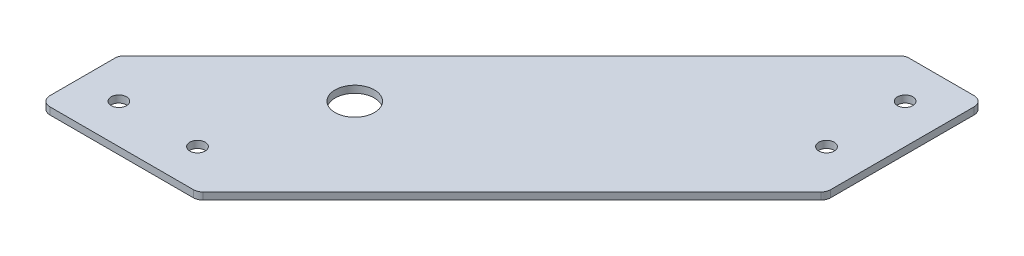
from build123d import *

# Parameters (mm, degrees)
SKETCH1_R           = 2.4892
SKETCH1_R_2         = 6.35
BOSS_EXTRUDE2_DEPTH = 1.143
CUT_EXTRUDE1_DEPTH  = 216.53826991
BOSS_EXTRUDE3_DEPTH = 2.286
FILLET3_R           = 3.175


with BuildPart() as part:
    # Sketch1 → Boss-Extrude2 (new, symmetric)
    with BuildSketch(Plane(origin=(0, 0, 0), x_dir=(1, 0, 0), z_dir=(0, 1, 0))):
        Polygon((0, 0), (0, 152.4), (-25.4, 152.4), (-152.4, 25.4), (-152.4, 0), align=None)
        with Locations((-12.7, 12.7)):
            Circle(SKETCH1_R, mode=Mode.SUBTRACT)
        with Locations((-38.1, 12.7)):
            Circle(SKETCH1_R, mode=Mode.SUBTRACT)
        with Locations((-63.5, 12.7)):
            Circle(SKETCH1_R, mode=Mode.SUBTRACT)
        with Locations((-88.9, 12.7)):
            Circle(SKETCH1_R, mode=Mode.SUBTRACT)
        with Locations((-114.3, 12.7)):
            Circle(SKETCH1_R, mode=Mode.SUBTRACT)
        with Locations((-12.7, 38.1)):
            Circle(SKETCH1_R, mode=Mode.SUBTRACT)
        with Locations((-12.7, 63.5)):
            Circle(SKETCH1_R, mode=Mode.SUBTRACT)
        with Locations((-12.7, 88.9)):
            Circle(SKETCH1_R, mode=Mode.SUBTRACT)
        with Locations((-12.7, 114.3)):
            Circle(SKETCH1_R, mode=Mode.SUBTRACT)
        with Locations((-139.7, 12.7)):
            Circle(SKETCH1_R, mode=Mode.SUBTRACT)
        with Locations((-12.7, 139.7)):
            Circle(SKETCH1_R, mode=Mode.SUBTRACT)
        with Locations((-101.6, 50.8)):
            Circle(SKETCH1_R_2, mode=Mode.SUBTRACT)
    extrude(amount=BOSS_EXTRUDE2_DEPTH, both=True)

    # Sketch2 → Cut-Extrude1 (cut, through all)
    with BuildSketch(Plane(origin=(0, 1.143, 0), x_dir=(1, 0, 0), z_dir=(0, 1, 0))):
        Polygon((0, 0), (0, 101.6), (-101.6, 0), align=None)
    extrude(amount=-CUT_EXTRUDE1_DEPTH, mode=Mode.SUBTRACT)

    # Sketch3 → Boss-Extrude3 (add)
    with BuildSketch(Plane(origin=(0, 1.143, 0), x_dir=(1, 0, 0), z_dir=(0, 1, 0))):
        Polygon((-101.6, 0), (-101.6, 15.120409187), (-15.612291765, 101.108117422), (0, 101.6), align=None)
    extrude(amount=-BOSS_EXTRUDE3_DEPTH)

    # Fillet3
    fillet3_edges = [part.edges().sort_by_distance(p)[0] for p in [
        (-152.4, 0, 0),
        (-25.4, 0, -152.4),
        (0, 0, -152.4),
        (0, 0, -101.6),
        (-101.6, 0, 0),
        (-152.4, 0, -25.4),
    ]]
    fillet(fillet3_edges, radius=FILLET3_R)


solid = part.part
